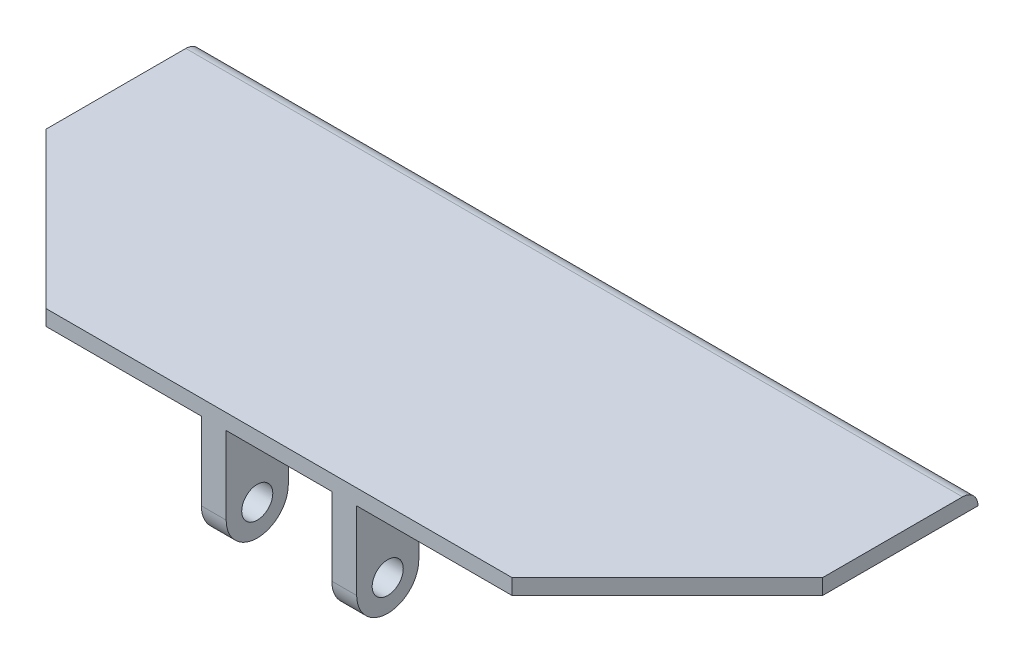
from build123d import *

# Parameters (mm, degrees)
SKETCH1_W           = 250
SKETCH1_H           = 100
BOSS_EXTRUDE1_DEPTH = 5
CHAMFER2_SIZE       = 50
FILLET1_R           = 5
SKETCH2_W           = 8
SKETCH2_H           = 20
BOSS_EXTRUDE2_DEPTH = 35
SKETCH4_R           = 5
CUT_EXTRUDE1_DEPTH  = 184.643676722
FILLET2_R           = 10


with BuildPart() as part:
    # Sketch1 → Boss-Extrude1 (new body)
    with BuildSketch(Plane(origin=(0, 0, 0), x_dir=(1, 0, 0), z_dir=(0, 1, 0))):
        with Locations((-125, 50)):
            Rectangle(SKETCH1_W, SKETCH1_H)
    extrude(amount=BOSS_EXTRUDE1_DEPTH)

    # Chamfer2
    chamfer2_edges = [part.edges().sort_by_distance(p)[0] for p in [
        (0, 2.5, 0),
        (-250, 2.5, 0),
    ]]
    chamfer(chamfer2_edges, length=CHAMFER2_SIZE)

    # Fillet1
    fillet1_edges = [part.edges().sort_by_distance(p)[0] for p in [
        (-125, 5, -100),
    ]]
    fillet(fillet1_edges, radius=FILLET1_R - 0.0001)  # a hair under: the kernel refuses the full size

    # Sketch2 → Boss-Extrude2 (add)
    with BuildSketch(Plane.XZ):
        with Locations((-146, -10)):
            Rectangle(SKETCH2_W, SKETCH2_H)
        with Locations((-104, -10)):
            Rectangle(SKETCH2_W, SKETCH2_H)
    extrude(amount=BOSS_EXTRUDE2_DEPTH)

    # Sketch4 → Cut-Extrude1 (cut, through all)
    with BuildSketch(Plane(origin=(-100, 0, 0), x_dir=(0, 0, -1), z_dir=(1, 0, 0))):
        with Locations((10, -25)):
            Circle(SKETCH4_R)
    extrude(amount=-CUT_EXTRUDE1_DEPTH, mode=Mode.SUBTRACT)

    # Fillet2
    fillet2_edges = [part.edges().sort_by_distance(p)[0] for p in [
        (-104, -35, -20),
        (-146, -35, -20),
        (-146, -35, 0),
        (-104, -35, 0),
    ]]
    fillet(fillet2_edges, radius=FILLET2_R - 0.0001)  # a hair under: the kernel refuses the full size


solid = part.part
